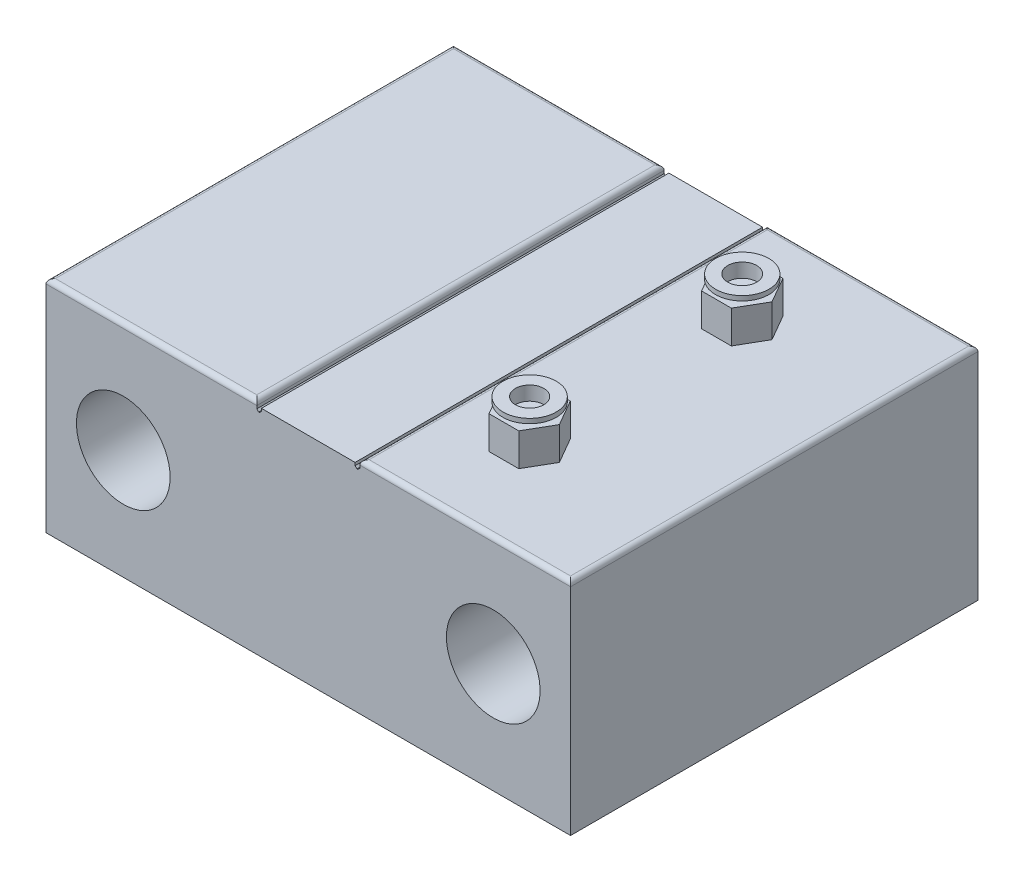
from build123d import *

# Parameters (mm, degrees)
CROQUIS1_W              = 112
CROQUIS1_H              = 47
SALIENTE_EXTRUIR1_DEPTH = 87
CROQUIS2_R              = 10
CORTAR_EXTRUIR1_DEPTH   = 87
CORTAR_EXTRUIR2_DEPTH   = 87
CHAFL_N1_SIZE           = 0.4
CHAFL_N2_SIZE           = 0.4
REDONDEO1_R             = 1
REDONDEO2_R             = 1
SALIENTE_EXTRUIR2_DEPTH = 7
CROQUIS6_R              = 3.472712807
SALIENTE_EXTRUIR3_DEPTH = 1
CROQUIS7_R              = 5.694419986
SALIENTE_EXTRUIR4_DEPTH = 1
CROQUIS8_R              = 3.033642273
CROQUIS8_R_2            = 3.0923226
CORTAR_EXTRUIR3_DEPTH   = 3


with BuildPart() as part:
    # Croquis1 → Saliente-Extruir1 (new body)
    with BuildSketch(Plane.XY):
        Rectangle(CROQUIS1_W, CROQUIS1_H)
    extrude(amount=-SALIENTE_EXTRUIR1_DEPTH)

    # Croquis2 → Cortar-Extruir1 (cut)
    with BuildSketch(Plane.XY):
        with Locations((-39.5, 0)):
            Circle(CROQUIS2_R)
        with Locations(Location((39.5, 0, 0), (0, 0, 180))):
            Circle(CROQUIS2_R)
    extrude(amount=-CORTAR_EXTRUIR1_DEPTH, mode=Mode.SUBTRACT)

    # Croquis4 → Cortar-Extruir2 (cut)
    with BuildSketch(Plane(origin=(0, 0, -87), x_dir=(-1, 0, 0), z_dir=(0, 0, -1))):
        Polygon((10, 22.5), (-10, 22.5), (-10, 21.5), (-11, 21.5), (-11, 23.5), (0, 25.805357454), (11, 23.5), (11, 21.5), (10, 21.5), align=None)
    extrude(amount=-CORTAR_EXTRUIR2_DEPTH, mode=Mode.SUBTRACT)

    # Chaflán1
    chafl_n1_edges = [part.edges().sort_by_distance(p)[0] for p in [
        (-11, 21.5, -43.5),
        (-10, 21.5, -43.5),
    ]]
    chamfer(chafl_n1_edges, length=CHAFL_N1_SIZE)

    # Chaflán2
    chafl_n2_edges = [part.edges().sort_by_distance(p)[0] for p in [
        (10, 21.5, -43.5),
        (11, 21.5, -43.5),
    ]]
    chamfer(chafl_n2_edges, length=CHAFL_N2_SIZE)

    # Redondeo1
    redondeo1_edges = [part.edges().sort_by_distance(p)[0] for p in [
        (-33.5, 23.5, 0),
        (-33.5, 23.5, -87),
        (33.5, 23.5, 0),
        (33.5, 23.5, -87),
        (-56, 23.5, -43.5),
        (56, 23.5, -43.5),
    ]]
    fillet(redondeo1_edges, radius=REDONDEO1_R)

    # Redondeo2
    # the kernel refuses this fillet: 1 mm, written as the material it takes off along each edge
    with BuildSketch(Plane(origin=(-11, 23.5, -88.5), x_dir=(0, -1, 0), z_dir=(0, 0, 1))) as redondeo2_piece_1:
        with BuildLine():
            CenterArc((REDONDEO2_R, -REDONDEO2_R), REDONDEO2_R, 90, 90)
            Line((0, -REDONDEO2_R), (0, 0))
            Line((0, 0), (REDONDEO2_R, 0))
        make_face()
    extrude(amount=90, mode=Mode.SUBTRACT)
    with BuildSketch(Plane(origin=(11, 23.5, -88.5), x_dir=(0, -1, 0), z_dir=(0, 0, 1))) as redondeo2_piece_2:
        with BuildLine():
            CenterArc((REDONDEO2_R, REDONDEO2_R), REDONDEO2_R, 180, 90)
            Line((0, REDONDEO2_R), (0, 0))
            Line((0, 0), (REDONDEO2_R, 0))
        make_face()
    extrude(amount=90, mode=Mode.SUBTRACT)

    # Croquis5 → Saliente-Extruir2 (add)
    with BuildSketch(Plane(origin=(0, 23.5, 0), x_dir=(1, 0, 0), z_dir=(0, 1, 0))):
        Polygon((32.814266538, 66.19625833), (29.638840058, 71.69625833), (23.287987096, 71.69625833), (20.112560616, 66.19625833), (23.287987096, 60.69625833), (29.638840058, 60.69625833), align=None)
        Polygon((29.638840058, 26.30374167), (32.814266538, 20.80374167), (29.638840058, 15.30374167), (23.287987096, 15.30374167), (20.112560616, 20.80374167), (23.287987096, 26.30374167), align=None)
    extrude(amount=SALIENTE_EXTRUIR2_DEPTH)

    # Croquis6 → Saliente-Extruir3 (add)
    with BuildSketch(Plane(origin=(0, 30.5, 0), x_dir=(1, 0, 0), z_dir=(0, 1, 0))):
        with Locations(Location((26.463413577, 66.19625833, 0), (0, 0, 270))):
            Circle(CROQUIS6_R)
        with Locations(Location((26.463413577, 20.80374167, 0), (0, 0, 90))):
            Circle(CROQUIS6_R)
    extrude(amount=SALIENTE_EXTRUIR3_DEPTH)

    # Croquis7 → Saliente-Extruir4 (add)
    with BuildSketch(Plane(origin=(0, 31.5, 0), x_dir=(1, 0, 0), z_dir=(0, 1, 0))):
        with Locations(Location((26.463413577, 20.80374167, 0), (0, 0, 270))):
            Circle(CROQUIS7_R)
        with Locations(Location((26.463413577, 66.19625833, 0), (0, 0, 90))):
            Circle(CROQUIS7_R)
    extrude(amount=SALIENTE_EXTRUIR4_DEPTH)

    # Croquis8 → Cortar-Extruir3 (cut)
    with BuildSketch(Plane(origin=(0, 32.5, 0), x_dir=(1, 0, 0), z_dir=(0, 1, 0))):
        with Locations(Location((26.463413577, 20.80374167, 0), (0, 0, 270))):
            Circle(CROQUIS8_R)
        with Locations(Location((26.463413577, 66.19625833, 0), (0, 0, 270))):
            Circle(CROQUIS8_R_2)
    extrude(amount=-CORTAR_EXTRUIR3_DEPTH, mode=Mode.SUBTRACT)


solid = part.part
